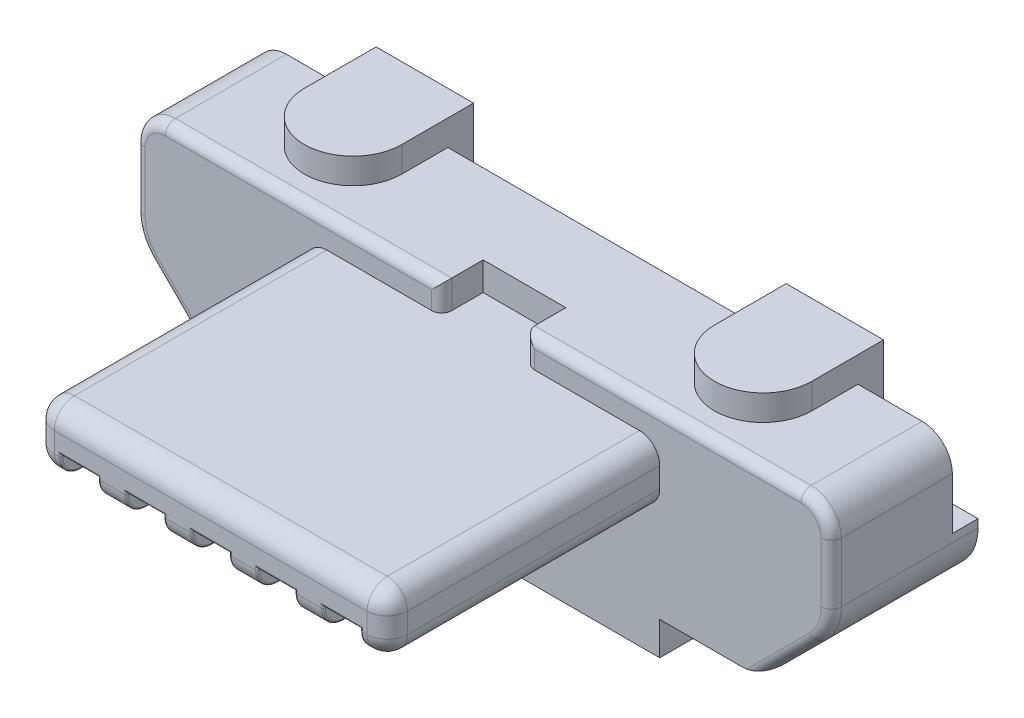
from build123d import *

# Parameters (mm, degrees)
BOSS_EXTRUDE1_DEPTH = 1.2
FILLET1_R           = 0.3
SKETCH5_W           = 3.5
SKETCH5_H           = 0.4
BOSS_EXTRUDE3_DEPTH = 0.28
CUT_EXTRUDE3_DEPTH  = 2.28
CUT_EXTRUDE4_DEPTH  = 2.28
SKETCH2_W           = 0.82
SKETCH2_H           = 0.82
CUT_EXTRUDE1_DEPTH  = 0.41
SKETCH3_W           = 3.5
SKETCH3_H           = 0.6
BOSS_EXTRUDE2_DEPTH = 2.7
FILLET5_R           = 0.2
FILLET7_R           = 0.5
FILLET8_R           = 0.1
SKETCH9_W           = 3.5
SKETCH9_H           = 0.6
BOSS_EXTRUDE4_DEPTH = 0.16
SKETCH10_W          = 0.37
SKETCH10_H          = 0.37
CUT_EXTRUDE5_DEPTH  = 2.7
SKETCH13_W          = 0.25
SKETCH13_H          = 0.15
SKETCH11_W          = 0.37
SKETCH11_H          = 0.15
CUT_EXTRUDE6_DEPTH  = 2.8
SKETCH14_W          = 0.25
SKETCH14_H          = 0.15
SKETCH16_W          = 0.25
SKETCH16_H          = 0.15
CUT_EXTRUDE7_DEPTH  = 0.16
SKETCH17_W          = 0.37
SKETCH17_H          = 0.15
BOSS_EXTRUDE5_DEPTH = 2.8
SKETCH18_W          = 0.37
SKETCH18_H          = 0.15
CUT_EXTRUDE8_DEPTH  = 0.15
FILLET10_R          = 0.1
SKETCH19_W          = 0.37
SKETCH19_H          = 0.15
BOSS_EXTRUDE6_DEPTH = 0.15
FILLET11_R          = 0.15
FILLET12_R          = 0.15
FILLET13_R          = 0.15
FILLET14_R          = 0.15
FILLET15_R          = 0.15
FILLET16_R          = 0.01
FILLET17_R          = 0.01
FILLET18_R          = 0.01
FILLET19_R          = 0.01
FILLET20_R          = 0.01
FILLET21_R          = 0.01
FILLET22_R          = 0.01
FILLET23_R          = 0.01
FILLET24_R          = 0.01
FILLET25_R          = 0.01
FILLET26_R          = 0.02
BOSS_EXTRUDE7_DEPTH = 0.254
BOSS_EXTRUDE8_DEPTH = 0.254


with BuildPart() as part:
    # Sketch1 → Boss-Extrude1 (new body)
    with BuildSketch(Plane.XY):
        Polygon((3.45, 0.925), (-3.45, 0.925), (-3.45, -0.175), (-2.7, -0.925), (2.7, -0.925), (3.45, -0.175), align=None)
    extrude(amount=BOSS_EXTRUDE1_DEPTH)

    # Fillet1
    fillet1_edges = [part.edges().sort_by_distance(p)[0] for p in [
        (-3.45, 0.925, 0.6),
        (3.45, 0.925, 0.6),
    ]]
    fillet(fillet1_edges, radius=FILLET1_R)

    # Sketch5 → Boss-Extrude3 (add)
    with BuildSketch(Plane.XZ.offset(0.925)):
        with Locations((0, 1)):
            Rectangle(SKETCH5_W, SKETCH5_H)
    extrude(amount=BOSS_EXTRUDE3_DEPTH)

    # Sketch7 → Cut-Extrude3 (cut)
    with BuildSketch(Plane.ZY.offset(1.75)):
        Polygon((0, -0.925), (1.2, -0.875), (1.2, -0.925), align=None)
    extrude(amount=CUT_EXTRUDE3_DEPTH, mode=Mode.SUBTRACT)

    # Sketch8 → Cut-Extrude4 (cut)
    with BuildSketch(Plane(origin=(1.75, 0, 0), x_dir=(0, 0, -1), z_dir=(1, 0, 0))):
        Polygon((0, -0.925), (-1.2, -0.875), (-1.2, -0.925), align=None)
    extrude(amount=CUT_EXTRUDE4_DEPTH, mode=Mode.SUBTRACT)

    # Sketch2 → Cut-Extrude1 (cut)
    with BuildSketch(Plane.XY.offset(1.2)):
        with Locations((0, 1.055)):
            Rectangle(SKETCH2_W, SKETCH2_H)
    extrude(amount=-CUT_EXTRUDE1_DEPTH, mode=Mode.SUBTRACT)

    # Sketch3 → Boss-Extrude2 (add)
    with BuildSketch(Plane.XY.offset(1.2)):
        with Locations((0, 0.345)):
            Rectangle(SKETCH3_W, SKETCH3_H)
    extrude(amount=BOSS_EXTRUDE2_DEPTH)

    # Fillet5
    fillet5_edges = [part.edges().sort_by_distance(p)[0] for p in [
        (0, 0.045, 3.9),
        (-1.75, 0.345, 3.9),
        (0, 0.645, 3.9),
        (1.75, 0.345, 3.9),
        (-1.75, 0.045, 2.55),
        (-1.75, 0.645, 2.55),
        (1.75, 0.045, 2.55),
        (1.75, 0.645, 2.55),
    ]]
    fillet(fillet5_edges, radius=FILLET5_R)

    # Fillet7
    fillet7_edges = [part.edges().sort_by_distance(p)[0] for p in [
        (3.45, -0.175, 0.6),
        (-3.45, -0.175, 0.6),
        (-2.725, -0.9, 0.6),
        (2.725, -0.9, 0.6),
    ]]
    fillet(fillet7_edges, radius=FILLET7_R)

    # Fillet8
    # the kernel refuses this fillet: 0.1 mm, written as the material it takes off along each edge
    with BuildSketch(Plane(origin=(-3.45, 0.625, 1.2), x_dir=(1, 0, 0), z_dir=(0, -1, 0)), Plane(origin=(3.45, 0.032106781, 1.2), x_dir=(-1, 0, 0), z_dir=(0, 1, 0))) as fillet8_piece_1:
        with BuildLine():
            CenterArc((FILLET8_R, -FILLET8_R), FILLET8_R, 90, 90)
            Line((0, -FILLET8_R), (0, 0))
            Line((0, 0), (FILLET8_R, 0))
        make_face()
    extrude(amount=0.592893219, mode=Mode.SUBTRACT)
    with BuildSketch(Plane(origin=(3.15, 0.625, 1.2), x_dir=(0, 1, 0), z_dir=(-1, 0, 0))) as fillet8_piece_2:
        with BuildLine():
            CenterArc((0.3 - FILLET8_R, FILLET8_R), FILLET8_R, 270, 90)
            Line((0.3, FILLET8_R), (0.3, 0))
            Line((0.3, 0), (0.3 - FILLET8_R, 0))
        make_face()
    revolve(axis=Axis((3.15, 0.625, 1.2), (0, 0, -1)), revolution_arc=90, mode=Mode.SUBTRACT)
    with BuildSketch(Plane(origin=(-3.15, 0.625, 1.2), x_dir=(0, 1, 0), z_dir=(1, 0, 0))) as fillet8_piece_3:
        with BuildLine():
            CenterArc((0.3 - FILLET8_R, -FILLET8_R), FILLET8_R, 0, 90)
            Line((0.3, -FILLET8_R), (0.3, 0))
            Line((0.3, 0), (0.3 - FILLET8_R, 0))
        make_face()
    revolve(axis=Axis((-3.15, 0.625, 1.2), (0, 0, 1)), revolution_arc=90, mode=Mode.SUBTRACT)
    with BuildSketch(Plane(origin=(0.41, 1.175, 1.2), x_dir=(1, 0, 0), z_dir=(0, -1, 0)), Plane(origin=(-0.41, 0.645, 1.2), x_dir=(-1, 0, 0), z_dir=(0, 1, 0))) as fillet8_piece_4:
        with BuildLine():
            CenterArc((FILLET8_R, -FILLET8_R), FILLET8_R, 90, 90)
            Line((0, -FILLET8_R), (0, 0))
            Line((0, 0), (FILLET8_R, 0))
        make_face()
    extrude(amount=0.53, mode=Mode.SUBTRACT)
    with BuildSketch(Plane(origin=(-0.16, 0.925, 1.2), x_dir=(0, -1, 0), z_dir=(-1, 0, 0)), Plane(origin=(3.15, 0.925, 1.2), x_dir=(0, -1, 0), z_dir=(-1, 0, 0))) as fillet8_piece_5:
        with BuildLine():
            CenterArc((FILLET8_R, -FILLET8_R), FILLET8_R, 90, 90)
            Line((0, -FILLET8_R), (0, 0))
            Line((0, 0), (FILLET8_R, 0))
        make_face()
    extrude(amount=2.99, mode=Mode.SUBTRACT)
    with BuildSketch(Plane(origin=(2.596360067, -1.028639933, 1.2), x_dir=(-0.7071067811865477, 0.7071067811865474, 0), z_dir=(0.7071067811865475, 0.7071067811865477, 0)), Plane(origin=(-3.303553391, -0.321446609, 1.2), x_dir=(0.7071067811865475, 0.7071067811865475, 0), z_dir=(0.7071067811865477, -0.7071067811865476, 0))) as fillet8_piece_6:
        with BuildLine():
            CenterArc((FILLET8_R, -FILLET8_R), FILLET8_R, 90, 90)
            Line((0, -FILLET8_R), (0, 0))
            Line((0, 0), (FILLET8_R, 0))
        make_face()
    extrude(amount=1.000122389, mode=Mode.SUBTRACT)
    with BuildSketch(Plane(origin=(2.95, 0.032106781, 1.2), x_dir=(0.7071067811865479, -0.7071067811865474, 0), z_dir=(-0.7071067811865474, -0.7071067811865479, 0))) as fillet8_piece_7:
        with BuildLine():
            CenterArc((0.5 - FILLET8_R, -FILLET8_R), FILLET8_R, 0, 90)
            Line((0.5, -FILLET8_R), (0.5, 0))
            Line((0.5, 0), (0.5 - FILLET8_R, 0))
        make_face()
    revolve(axis=Axis((2.95, 0.032106781, 1.2), (0, 0, 1)), revolution_arc=45, mode=Mode.SUBTRACT)
    with BuildSketch(Plane(origin=(-2.95, 0.032106781, 1.2), x_dir=(-1, 0, 0), z_dir=(0, 1, 0))) as fillet8_piece_8:
        with BuildLine():
            CenterArc((0.5 - FILLET8_R, -FILLET8_R), FILLET8_R, 0, 90)
            Line((0.5, -FILLET8_R), (0.5, 0))
            Line((0.5, 0), (0.5 - FILLET8_R, 0))
        make_face()
    revolve(axis=Axis((-2.95, 0.032106781, 1.2), (0, 0, 1)), revolution_arc=45, mode=Mode.SUBTRACT)

    # Sketch9 → Boss-Extrude4 (add)
    with BuildSketch(Plane.XZ.offset(0.925)):
        with Locations((0, 0.35)):
            Rectangle(SKETCH9_W, SKETCH9_H)
    extrude(amount=BOSS_EXTRUDE4_DEPTH)

    # Sketch10 → Cut-Extrude5 (cut)
    with BuildSketch(Plane.XY.offset(3.9)):
        with Locations((-1.3, 0.08)):
            Rectangle(SKETCH10_W, SKETCH10_H)
        with Locations((-0.65, 0.08)):
            Rectangle(SKETCH10_W, SKETCH10_H)
        with Locations((0, 0.08)):
            Rectangle(SKETCH10_W, SKETCH10_H)
        with Locations((0.65, 0.08)):
            Rectangle(SKETCH10_W, SKETCH10_H)
        with Locations((1.3, 0.08)):
            Rectangle(SKETCH10_W, SKETCH10_H)
    extrude(amount=-CUT_EXTRUDE5_DEPTH, mode=Mode.SUBTRACT)

    # Cut-Sweep2: sweep along a path in Sketch12
    with BuildLine(Plane(origin=(0, 0, 0), x_dir=(0, 0, -1), z_dir=(1, 0, 0))) as cut_sweep2_path:
        Line((-3.7, 0.315), (-0.55, 0.315))
        ThreePointArc((-0.55, 0.315), (-0.408578644, 0.256421356), (-0.35, 0.115))
        Line((-0.35, 0.115), (-0.35, -1.085))
    # Sketch13 → Cut-Sweep2 (sweep, cut)
    with BuildSketch(Plane.XY.offset(3.7)):
        with Locations((-1.3, 0.24)):
            Rectangle(SKETCH13_W, SKETCH13_H)
        with Locations((-0.65, 0.24)):
            Rectangle(SKETCH13_W, SKETCH13_H)
        with Locations((0, 0.24)):
            Rectangle(SKETCH13_W, SKETCH13_H)
        with Locations((0.65, 0.24)):
            Rectangle(SKETCH13_W, SKETCH13_H)
        with Locations((1.3, 0.24)):
            Rectangle(SKETCH13_W, SKETCH13_H)
    sweep(path=cut_sweep2_path.line, mode=Mode.SUBTRACT)

    # Sketch11 → Cut-Extrude6 (cut)
    with BuildSketch(Plane.XY.offset(3.7)):
        with Locations((-1.3, 0.24)):
            Rectangle(SKETCH11_W, SKETCH11_H)
        with Locations((-0.65, 0.24)):
            Rectangle(SKETCH11_W, SKETCH11_H)
        with Locations((0, 0.24)):
            Rectangle(SKETCH11_W, SKETCH11_H)
        with Locations((0.65, 0.24)):
            Rectangle(SKETCH11_W, SKETCH11_H)
        with Locations((1.3, 0.24)):
            Rectangle(SKETCH11_W, SKETCH11_H)
    extrude(amount=-CUT_EXTRUDE6_DEPTH, mode=Mode.SUBTRACT)

    # Sketch16 → Cut-Extrude7 (cut)
    with BuildSketch(Plane.XZ.offset(1.085)):
        with Locations((-1.3, 0.575)):
            Rectangle(SKETCH16_W, SKETCH16_H)
        with Locations((-0.65, 0.575)):
            Rectangle(SKETCH16_W, SKETCH16_H)
        with Locations((0, 0.575)):
            Rectangle(SKETCH16_W, SKETCH16_H)
        with Locations((0.65, 0.575)):
            Rectangle(SKETCH16_W, SKETCH16_H)
        with Locations((1.3, 0.575)):
            Rectangle(SKETCH16_W, SKETCH16_H)
    extrude(amount=-CUT_EXTRUDE7_DEPTH, mode=Mode.SUBTRACT)

    # Sketch18 → Cut-Extrude8 (cut)
    with BuildSketch(Plane.XZ.offset(-0.315)):
        with Locations((1.3, 3.625)):
            Rectangle(SKETCH18_W, SKETCH18_H)
        with Locations((0.65, 3.625)):
            Rectangle(SKETCH18_W, SKETCH18_H)
        with Locations((0, 3.625)):
            Rectangle(SKETCH18_W, SKETCH18_H)
        with Locations((-0.65, 3.625)):
            Rectangle(SKETCH18_W, SKETCH18_H)
        with Locations((-1.3, 3.625)):
            Rectangle(SKETCH18_W, SKETCH18_H)
    extrude(amount=-CUT_EXTRUDE8_DEPTH, mode=Mode.SUBTRACT)

    # Fillet10
    fillet10_edges = [part.edges().sort_by_distance(p)[0] for p in [
        (-1.3, -1.085, 0.35),
        (-0.65, -1.085, 0.35),
        (0, -1.085, 0.35),
        (0.65, -1.085, 0.35),
        (1.3, -1.085, 0.35),
        (1.3, 0.315, 3.55),
        (0.65, 0.315, 3.55),
        (0, 0.315, 3.55),
        (-0.65, 0.315, 3.55),
        (-1.3, 0.315, 3.55),
    ]]
    fillet(fillet10_edges, radius=FILLET10_R)

    # Fillet26
    fillet26_edges = [part.edges().sort_by_distance(p)[0] for p in [
        (-1.115, 0.103578644, 3.841421356),
        (-1.485, 0.103578644, 3.841421356),
        (-1.485, 0.045, 2.45),
        (-1.115, 0.045, 2.45),
        (-1.485, 0.255, 3.9),
        (-1.115, 0.255, 3.9),
        (-1.3, 0.265, 3.9),
        (-0.465, 0.103578644, 3.841421356),
        (-0.835, 0.103578644, 3.841421356),
        (-0.835, 0.045, 2.45),
        (-0.465, 0.045, 2.45),
        (-0.835, 0.255, 3.9),
        (-0.465, 0.255, 3.9),
        (-0.65, 0.265, 3.9),
        (0.185, 0.103578644, 3.841421356),
        (-0.185, 0.103578644, 3.841421356),
        (-0.185, 0.045, 2.45),
        (0.185, 0.045, 2.45),
        (-0.185, 0.255, 3.9),
        (0.185, 0.255, 3.9),
        (0, 0.265, 3.9),
        (0.835, 0.103578644, 3.841421356),
        (0.465, 0.103578644, 3.841421356),
        (0.465, 0.045, 2.45),
        (0.835, 0.045, 2.45),
        (0.465, 0.255, 3.9),
        (0.835, 0.255, 3.9),
        (0.65, 0.265, 3.9),
        (1.485, 0.103578644, 3.841421356),
        (1.115, 0.103578644, 3.841421356),
        (1.115, 0.045, 2.45),
        (1.485, 0.045, 2.45),
        (1.115, 0.255, 3.9),
        (1.485, 0.255, 3.9),
        (1.3, 0.265, 3.9),
    ]]
    fillet(fillet26_edges, radius=FILLET26_R)

    # Sketch20 → Boss-Extrude7 (add)
    with BuildSketch(Plane(origin=(0, 0, 0), x_dir=(-1, 0, 0), z_dir=(0, 0, -1))):
        with BuildLine():
            Line((1.5494, 0.925), (2.5146, 0.925))
            Line((2.5146, 0.925), (2.5146, 0.1122))
            Line((2.5146, 0.1122), (3.026, 0.1122))
            Line((3.026, 0.1122), (3.45, 0.1122))
            Line((3.45, 0.1122), (3.45, 0.032106781))
            ThreePointArc((3.45, 0.032106781), (3.411939766, -0.159234935), (3.303553391, -0.321446609))
            Line((3.303553391, -0.321446609), (3.026, -0.599))
            Line((3.026, -0.599), (2.5146, -0.599))
            Line((2.5146, -0.599), (2.5146, -0.924510031))
            Line((2.5146, -0.924510031), (1.5494, -0.924510031))
            Line((1.5494, -0.924510031), (1.5494, 0.925))
        make_face()
    boss_extrude7 = extrude(amount=BOSS_EXTRUDE7_DEPTH)

    # Sketch21 → Boss-Extrude8 (add)
    with BuildSketch(Plane(origin=(0, 0.925, 0), x_dir=(1, 0, 0), z_dir=(0, 1, 0))):
        with BuildLine():
            Line((-1.5494, 0.254), (-2.5146, 0.254))
            Line((-2.5146, 0.254), (-2.5146, -0.4572))
            ThreePointArc((-2.5146, -0.4572), (-2.032, -0.9398), (-1.5494, -0.4572))
            Line((-1.5494, -0.4572), (-1.5494, 0.254))
        make_face()
    boss_extrude8 = extrude(amount=BOSS_EXTRUDE8_DEPTH)

    # Mirror1: Boss-Extrude7, Boss-Extrude8 across plane
    add(boss_extrude7.mirror(Plane(origin=(0, 0, 0), x_dir=(0, 0, 1), z_dir=(1, 0, 0))))
    add(boss_extrude8.mirror(Plane(origin=(0, 0, 0), x_dir=(0, 0, 1), z_dir=(1, 0, 0))))


with BuildPart() as body_2:
    # Sweep3: sweep along a path in Sketch15
    with BuildLine(Plane(origin=(0, 0, 0), x_dir=(0, 0, -1), z_dir=(1, 0, 0))) as sweep3_path:
        Line((0.889, -1.085), (-0.3, -1.085))
        ThreePointArc((-0.3, -1.085), (-0.335355339, -1.070355339), (-0.35, -1.035))
        Line((-0.35, -1.035), (-0.35, 0.115))
        ThreePointArc((-0.35, 0.115), (-0.408578644, 0.256421356), (-0.55, 0.315))
        Line((-0.55, 0.315), (-3.7, 0.315))
    # Sketch14 → Sweep3 (sweep)
    with BuildSketch(Plane.XY.offset(3.7)):
        with Locations((-1.3, 0.24)):
            Rectangle(SKETCH14_W, SKETCH14_H)
        with Locations((1.3, 0.24)):
            Rectangle(SKETCH14_W, SKETCH14_H)
        with Locations((0.65, 0.24)):
            Rectangle(SKETCH14_W, SKETCH14_H)
        with Locations((0, 0.24)):
            Rectangle(SKETCH14_W, SKETCH14_H)
        with Locations((-0.65, 0.24)):
            Rectangle(SKETCH14_W, SKETCH14_H)
    sweep(path=sweep3_path.line)

    # Sketch17 → Boss-Extrude5 (add)
    with BuildSketch(Plane.XY.offset(3.7)):
        with Locations((-0.65, 0.24)):
            Rectangle(SKETCH17_W, SKETCH17_H)
        with Locations((-1.3, 0.24)):
            Rectangle(SKETCH17_W, SKETCH17_H)
        with Locations((1.3, 0.24)):
            Rectangle(SKETCH17_W, SKETCH17_H)
        with Locations((0.65, 0.24)):
            Rectangle(SKETCH17_W, SKETCH17_H)
        with Locations((0, 0.24)):
            Rectangle(SKETCH17_W, SKETCH17_H)
    extrude(amount=-BOSS_EXTRUDE5_DEPTH)

    # Sketch19 → Boss-Extrude6 (add)
    with BuildSketch(Plane(origin=(0, 0.315, 0), x_dir=(1, 0, 0), z_dir=(0, 1, 0))):
        with Locations((-1.3, -3.625)):
            Rectangle(SKETCH19_W, SKETCH19_H)
        with Locations((-0.65, -3.625)):
            Rectangle(SKETCH19_W, SKETCH19_H)
        with Locations((0, -3.625)):
            Rectangle(SKETCH19_W, SKETCH19_H)
        with Locations((0.65, -3.625)):
            Rectangle(SKETCH19_W, SKETCH19_H)
        with Locations((1.3, -3.625)):
            Rectangle(SKETCH19_W, SKETCH19_H)
    extrude(amount=BOSS_EXTRUDE6_DEPTH)

    # Fillet11
    fillet11_edges = [body_2.edges().sort_by_distance(p)[0] for p in [
        (1.3, 0.165, 3.7),
    ]]
    fillet(fillet11_edges, radius=FILLET11_R)

    # Fillet12
    fillet12_edges = [body_2.edges().sort_by_distance(p)[0] for p in [
        (0.65, 0.165, 3.7),
    ]]
    fillet(fillet12_edges, radius=FILLET12_R)

    # Fillet13
    fillet13_edges = [body_2.edges().sort_by_distance(p)[0] for p in [
        (0, 0.165, 3.7),
    ]]
    fillet(fillet13_edges, radius=FILLET13_R)

    # Fillet14
    fillet14_edges = [body_2.edges().sort_by_distance(p)[0] for p in [
        (-0.65, 0.165, 3.7),
    ]]
    fillet(fillet14_edges, radius=FILLET14_R)

    # Fillet15
    fillet15_edges = [body_2.edges().sort_by_distance(p)[0] for p in [
        (-1.3, 0.165, 3.7),
    ]]
    fillet(fillet15_edges, radius=FILLET15_R)

    # Fillet16
    fillet16_edges = [body_2.edges().sort_by_distance(p)[0] for p in [
        (-1.425, 0.150355339, 0.514644661),
        (-1.175, 0.150355339, 0.514644661),
        (-1.425, -0.46, 0.5),
        (-1.175, -0.46, 0.5),
        (-1.425, -1.176421356, 0.441421356),
        (-1.175, -1.176421356, 0.441421356),
        (-1.3, -1.235, -0.889),
        (-1.425, -1.235, -0.2945),
        (-1.175, -1.235, -0.2945),
        (-1.175, 0.165, 0.725),
        (-1.425, 0.165, 0.725),
    ]]
    fillet(fillet16_edges, radius=FILLET16_R)

    # Fillet17
    fillet17_edges = [body_2.edges().sort_by_distance(p)[0] for p in [
        (-0.775, 0.150355339, 0.514644661),
        (-0.525, 0.150355339, 0.514644661),
        (-0.775, -0.46, 0.5),
        (-0.525, -0.46, 0.5),
        (-0.775, -1.176421356, 0.441421356),
        (-0.525, -1.176421356, 0.441421356),
        (-0.65, -1.235, -0.889),
        (-0.775, -1.235, -0.2945),
        (-0.525, -1.235, -0.2945),
        (-0.525, 0.165, 0.725),
        (-0.775, 0.165, 0.725),
    ]]
    fillet(fillet17_edges, radius=FILLET17_R)

    # Fillet18
    fillet18_edges = [body_2.edges().sort_by_distance(p)[0] for p in [
        (-0.125, 0.150355339, 0.514644661),
        (0.125, 0.150355339, 0.514644661),
        (-0.125, -0.46, 0.5),
        (0.125, -0.46, 0.5),
        (-0.125, -1.176421356, 0.441421356),
        (0.125, -1.176421356, 0.441421356),
        (0, -1.235, -0.889),
        (-0.125, -1.235, -0.2945),
        (0.125, -1.235, -0.2945),
        (0.125, 0.165, 0.725),
        (-0.125, 0.165, 0.725),
    ]]
    fillet(fillet18_edges, radius=FILLET18_R)

    # Fillet19
    fillet19_edges = [body_2.edges().sort_by_distance(p)[0] for p in [
        (0.525, 0.150355339, 0.514644661),
        (0.775, 0.150355339, 0.514644661),
        (0.525, -0.46, 0.5),
        (0.775, -0.46, 0.5),
        (0.525, -1.176421356, 0.441421356),
        (0.775, -1.176421356, 0.441421356),
        (0.65, -1.235, -0.889),
        (0.525, -1.235, -0.2945),
        (0.775, -1.235, -0.2945),
        (0.775, 0.165, 0.725),
        (0.525, 0.165, 0.725),
    ]]
    fillet(fillet19_edges, radius=FILLET19_R)

    # Fillet20
    fillet20_edges = [body_2.edges().sort_by_distance(p)[0] for p in [
        (1.175, 0.150355339, 0.514644661),
        (1.425, 0.150355339, 0.514644661),
        (1.175, -0.46, 0.5),
        (1.425, -0.46, 0.5),
        (1.175, -1.176421356, 0.441421356),
        (1.425, -1.176421356, 0.441421356),
        (1.3, -1.235, -0.889),
        (1.175, -1.235, -0.2945),
        (1.425, -1.235, -0.2945),
        (1.425, 0.165, 0.725),
        (1.175, 0.165, 0.725),
    ]]
    fillet(fillet20_edges, radius=FILLET20_R)

    # Fillet21
    fillet21_edges = [body_2.edges().sort_by_distance(p)[0] for p in [
        (1.425, 0.256421356, 0.408578644),
        (1.175, 0.256421356, 0.408578644),
        (1.425, -0.46, 0.35),
        (1.175, -0.46, 0.35),
        (1.425, -1.070355339, 0.335355339),
        (1.175, -1.070355339, 0.335355339),
        (1.3, -1.085, -0.889),
        (1.425, -1.085, -0.2945),
        (1.175, -1.085, -0.2945),
        (1.175, 0.315, 0.725),
        (1.425, 0.315, 0.725),
    ]]
    fillet(fillet21_edges, radius=FILLET21_R)

    # Fillet22
    fillet22_edges = [body_2.edges().sort_by_distance(p)[0] for p in [
        (0.775, 0.256421356, 0.408578644),
        (0.525, 0.256421356, 0.408578644),
        (0.775, -0.46, 0.35),
        (0.525, -0.46, 0.35),
        (0.775, -1.070355339, 0.335355339),
        (0.525, -1.070355339, 0.335355339),
        (0.65, -1.085, -0.889),
        (0.775, -1.085, -0.2945),
        (0.525, -1.085, -0.2945),
        (0.525, 0.315, 0.725),
        (0.775, 0.315, 0.725),
    ]]
    fillet(fillet22_edges, radius=FILLET22_R)

    # Fillet23
    fillet23_edges = [body_2.edges().sort_by_distance(p)[0] for p in [
        (0.125, 0.256421356, 0.408578644),
        (-0.125, 0.256421356, 0.408578644),
        (0.125, -0.46, 0.35),
        (-0.125, -0.46, 0.35),
        (0.125, -1.070355339, 0.335355339),
        (-0.125, -1.070355339, 0.335355339),
        (0, -1.085, -0.889),
        (0.125, -1.085, -0.2945),
        (-0.125, -1.085, -0.2945),
        (-0.125, 0.315, 0.725),
        (0.125, 0.315, 0.725),
    ]]
    fillet(fillet23_edges, radius=FILLET23_R)

    # Fillet24
    fillet24_edges = [body_2.edges().sort_by_distance(p)[0] for p in [
        (-0.525, 0.256421356, 0.408578644),
        (-0.775, 0.256421356, 0.408578644),
        (-0.525, -0.46, 0.35),
        (-0.775, -0.46, 0.35),
        (-0.525, -1.070355339, 0.335355339),
        (-0.775, -1.070355339, 0.335355339),
        (-0.65, -1.085, -0.889),
        (-0.525, -1.085, -0.2945),
        (-0.775, -1.085, -0.2945),
        (-0.775, 0.315, 0.725),
        (-0.525, 0.315, 0.725),
    ]]
    fillet(fillet24_edges, radius=FILLET24_R)

    # Fillet25
    fillet25_edges = [body_2.edges().sort_by_distance(p)[0] for p in [
        (-1.175, 0.256421356, 0.408578644),
        (-1.425, 0.256421356, 0.408578644),
        (-1.175, -0.46, 0.35),
        (-1.425, -0.46, 0.35),
        (-1.175, -1.070355339, 0.335355339),
        (-1.425, -1.070355339, 0.335355339),
        (-1.3, -1.085, -0.889),
        (-1.175, -1.085, -0.2945),
        (-1.425, -1.085, -0.2945),
        (-1.425, 0.315, 0.725),
        (-1.175, 0.315, 0.725),
    ]]
    fillet(fillet25_edges, radius=FILLET25_R)


solid = Compound([part.part, body_2.part])
